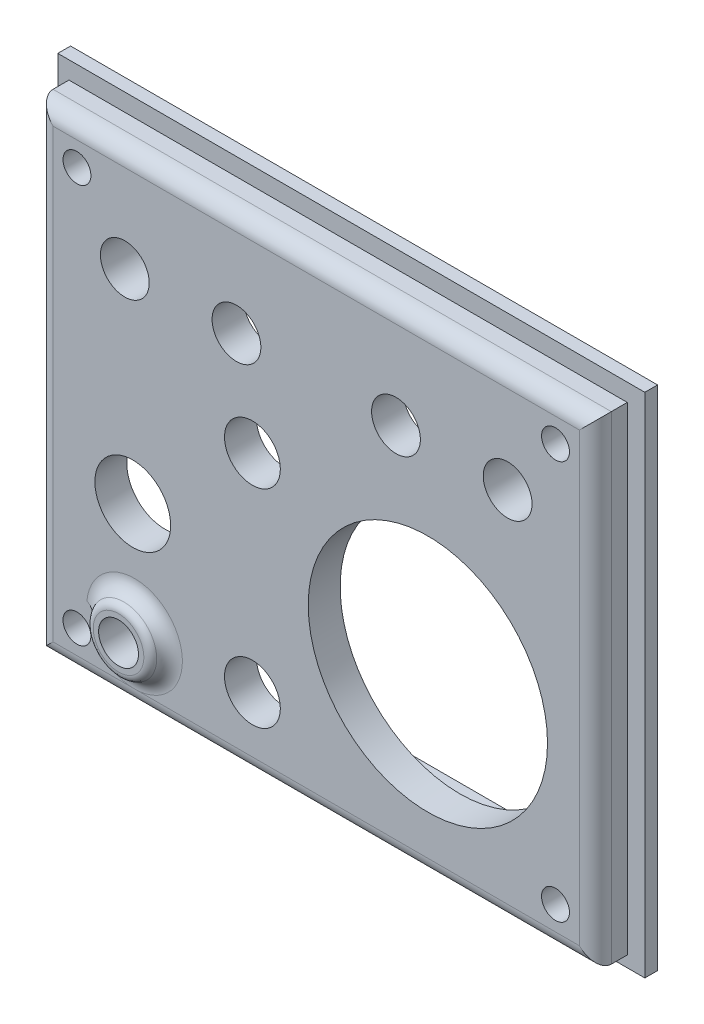
from build123d import *

# Parameters (mm, degrees)
SKETCH1_W               = 70
SKETCH1_H               = 60
BOSS_EXTRUDE1_DEPTH     = 4
SKETCH2_W               = 63.6
SKETCH2_H               = 53.6
SKETCH2_W_2             = 57.6
SKETCH2_H_2             = 47.6
BOSS_EXTRUDE2_DEPTH     = 2
CHAMFER1_SIZE           = 0.5
CHAMFER1_SIZE2          = 1.37373871
FILLET1_R               = 2
SKETCH3_R               = 3.060318858
CUT_EXTRUDE1_DEPTH      = 47.486557197
SKETCH4_R               = 15
CUT_EXTRUDE2_DEPTH      = 47.486557197
SKETCH5_R               = 3.5
CUT_EXTRUDE3_DEPTH      = 47.486557197
SKETCH6_R               = 5
SKETCH6_R_2             = 3.060318858
BOSS_EXTRUDE3_DEPTH     = 2
FILLET2_R               = 1
CUT_EXTRUDE4_REACH      = 48.487
SKETCH7_W               = 20
SKETCH7_H               = 60
SKETCH8_R               = 4.75
CUT_EXTRUDE5_DEPTH      = 47.270941205
CUT_EXTRUDE6_DEPTH      = 47.270941205
CUT_EXTRUDE6_DEPTH_BACK = 47.270941205
SKETCH9_R               = 1.75
SKETCH10_R              = 2
CUT_EXTRUDE7_DEPTH      = 2
SKETCH11_R              = 5
SKETCH11_R_2            = 3.060318858
BOSS_EXTRUDE4_DEPTH     = 2
SKETCH12_R              = 5
CUT_EXTRUDE9_DEPTH      = 47.270941205
SKETCH13_R              = 2.5
CUT_EXTRUDE10_DEPTH     = 47.270941205
SKETCH14_W              = 9
SKETCH14_H              = 9
SKETCH14_W_2            = 6.5
SKETCH14_H_2            = 6.5
BOSS_EXTRUDE5_DEPTH     = 2
SKETCH17_R              = 4
SKETCH17_R_2            = 2.5
BOSS_EXTRUDE7_DEPTH     = 2
FILLET5_R               = 2
FILLET6_R               = 1
SKETCH18_R              = 3.75
CUT_EXTRUDE13_DEPTH     = 47.486557197
BOSS_EXTRUDE8_START     = 0.4
SKETCH19_W              = 73.6
SKETCH19_H              = 63.6
SKETCH19_W_2            = 65.6
SKETCH19_H_2            = 55.6
BOSS_EXTRUDE8_DEPTH     = 1.6
SKETCH21_R              = 9.090654542
CUT_EXTRUDE15_DEPTH     = 50.004897727
SKETCH20_W              = 4.957633968
SKETCH20_H              = 6.255912851
SUPPORT_DEPTH           = 1.6


with BuildPart() as part:
    # Sketch1 → Boss-Extrude1 (new body)
    with BuildSketch(Plane.XY):
        Rectangle(SKETCH1_W, SKETCH1_H)
    extrude(amount=BOSS_EXTRUDE1_DEPTH)

    # Sketch2 → Boss-Extrude2 (add)
    with BuildSketch(Plane(origin=(0, 0, 0), x_dir=(-1, 0, 0), z_dir=(0, 0, -1))):
        Rectangle(SKETCH2_W, SKETCH2_H)
        Rectangle(SKETCH2_W_2, SKETCH2_H_2, mode=Mode.SUBTRACT)
    extrude(amount=BOSS_EXTRUDE2_DEPTH)

    # Chamfer1
    chamfer1_edges = [part.edges().sort_by_distance(p)[0] for p in [
        (-31.8, 0, -2),
        (0, 26.8, -2),
        (31.8, 0, -2),
        (0, -26.8, -2),
    ]]
    chamfer1_side = [part.faces().sort_by_distance(p)[0] for p in [
        (0, 25.968259656, -2),
    ]]
    chamfer(chamfer1_edges, length=CHAMFER1_SIZE, length2=CHAMFER1_SIZE2, reference=chamfer1_side[0])

    # Fillet1
    fillet1_edges = [part.edges().sort_by_distance(p)[0] for p in [
        (35, 0, 4),
        (0, 30, 4),
        (-35, 0, 4),
        (0, -30, 4),
    ]]
    fillet(fillet1_edges, radius=FILLET1_R)

    # Sketch3 → Cut-Extrude1 (cut, through all)
    with BuildSketch(Plane.XY.offset(4)):
        with Locations((-24, 17)):
            Circle(SKETCH3_R)
        with Locations((10, 17)):
            Circle(SKETCH3_R)
        with Locations((-10, 17)):
            Circle(SKETCH3_R)
        with Locations((24, 17)):
            Circle(SKETCH3_R)
    extrude(amount=-CUT_EXTRUDE1_DEPTH, mode=Mode.SUBTRACT)

    # Sketch4 → Cut-Extrude2 (cut, through all)
    with BuildSketch(Plane.XY.offset(4)):
        with Locations((14, -8)):
            Circle(SKETCH4_R)
    extrude(amount=-CUT_EXTRUDE2_DEPTH, mode=Mode.SUBTRACT)

    # Sketch5 → Cut-Extrude3 (cut, through all)
    with BuildSketch(Plane.XY.offset(4)):
        with Locations((-8, 5)):
            Circle(SKETCH5_R)
        with Locations((-8, -21)):
            Circle(SKETCH5_R)
    extrude(amount=-CUT_EXTRUDE3_DEPTH, mode=Mode.SUBTRACT)

    # Sketch6 → Boss-Extrude3 (add)
    # profile 1 of 2: a face of its own
    with BuildSketch(Plane(origin=(0, 0, 0), x_dir=(-1, 0, 0), z_dir=(0, 0, -1))):
        with Locations((24, 17)):
            Circle(SKETCH6_R)
        with Locations(Location((24, 17, 0), (0, 0, 180))):
            Circle(SKETCH6_R_2, mode=Mode.SUBTRACT)
    # profile 2 of 2: a face of its own
    with BuildSketch(Plane(origin=(0, 0, 0), x_dir=(-1, 0, 0), z_dir=(0, 0, -1))):
        with Locations((-24, 17)):
            Circle(SKETCH6_R)
        with Locations(Location((-24, 17, 0), (0, 0, 180))):
            Circle(SKETCH6_R_2, mode=Mode.SUBTRACT)
    extrude(amount=BOSS_EXTRUDE3_DEPTH)

    # Fillet2
    fillet2_edges = [part.edges().sort_by_distance(p)[0] for p in [
        (28.8, 18.4, -1),
        (28.8, 15.6, -1),
        (28.8, 23.8, -1),
    ]]
    fillet(fillet2_edges, radius=FILLET2_R)

    # Cut-Extrude4: up to this face of the body (flat: up to its plane)
    cut_extrude4_end = Plane(part.part.faces().sort_by_distance((-5.37613494, 1.437428998, 0))[0])
    # Sketch7 → Cut-Extrude4 (cut, up to the picked face)
    with BuildSketch(Plane(origin=(0, 0, -2), x_dir=(-1, 0, 0), z_dir=(0, 0, -1)), mode=Mode.PRIVATE) as cut_extrude4_sk1:
        with Locations((25, -2.259161332)):
            Rectangle(SKETCH7_W, SKETCH7_H)
    cut_extrude4_tool1 = split(extrude(cut_extrude4_sk1.sketch, amount=-CUT_EXTRUDE4_REACH, mode=Mode.PRIVATE), bisect_by=cut_extrude4_end, keep=Keep.BOTH, mode=Mode.PRIVATE)
    add(cut_extrude4_tool1.solids().sort_by(Axis((-25, -2.259161, -2), (0, 0, 1)))[0], mode=Mode.SUBTRACT)

    # Sketch8 → Cut-Extrude5 (cut, through all)
    with BuildSketch(Plane(origin=(0, 0, 0), x_dir=(-1, 0, 0), z_dir=(0, 0, -1))):
        with Locations((23, -8)):
            Circle(SKETCH8_R)
    extrude(amount=-CUT_EXTRUDE5_DEPTH, mode=Mode.SUBTRACT)

    # Sketch9 → Cut-Extrude6 (cut, two sides: drawn at the far end of the back side and taken through both)
    with BuildSketch(Plane(origin=(0, 0, 0), x_dir=(-1, 0, 0), z_dir=(0, 0, -1)).offset(-CUT_EXTRUDE6_DEPTH_BACK)):
        with Locations((30, 25)):
            Circle(SKETCH9_R)
        with Locations((30, -25)):
            Circle(SKETCH9_R)
        with Locations((-30, -25)):
            Circle(SKETCH9_R)
        with Locations((-30, 25)):
            Circle(SKETCH9_R)
    extrude(amount=CUT_EXTRUDE6_DEPTH + CUT_EXTRUDE6_DEPTH_BACK, mode=Mode.SUBTRACT)

    # Sketch10 → Cut-Extrude7 (cut)
    with BuildSketch(Plane(origin=(0, 0, 0), x_dir=(-1, 0, 0), z_dir=(0, 0, -1))):
        with Locations((23, 1)):
            Circle(SKETCH10_R)
    extrude(amount=-CUT_EXTRUDE7_DEPTH, mode=Mode.SUBTRACT)

    # Sketch11 → Boss-Extrude4 (add)
    with BuildSketch(Plane(origin=(0, 0, 0), x_dir=(-1, 0, 0), z_dir=(0, 0, -1))):
        with Locations(Location((24, 17, 0), (0, 0, 180))):
            Circle(SKETCH11_R)
        with Locations(Location((24, 17, 0), (0, 0, 180))):
            Circle(SKETCH11_R_2, mode=Mode.SUBTRACT)
    extrude(amount=BOSS_EXTRUDE4_DEPTH)

    # Sketch12 → Cut-Extrude9 (cut, through all)
    with BuildSketch(Plane(origin=(0, 0, 0), x_dir=(-1, 0, 0), z_dir=(0, 0, -1))):
        with Locations((-30, 25)):
            Circle(SKETCH12_R)
        with Locations((-30, -25)):
            Circle(SKETCH12_R)
    extrude(amount=CUT_EXTRUDE9_DEPTH, mode=Mode.SUBTRACT)

    # Sketch13 → Cut-Extrude10 (cut, through all)
    with BuildSketch(Plane(origin=(0, 0, 0), x_dir=(-1, 0, 0), z_dir=(0, 0, -1))):
        with Locations((22.783208656, -22)):
            Circle(SKETCH13_R)
    extrude(amount=-CUT_EXTRUDE10_DEPTH, mode=Mode.SUBTRACT)

    # Sketch14 → Boss-Extrude5 (add)
    with BuildSketch(Plane(origin=(0, 0, 0), x_dir=(-1, 0, 0), z_dir=(0, 0, -1))):
        with Locations((22.783208656, -22)):
            Rectangle(SKETCH14_W, SKETCH14_H)
        with Locations((22.783208656, -22)):
            Rectangle(SKETCH14_W_2, SKETCH14_H_2, mode=Mode.SUBTRACT)
    extrude(amount=BOSS_EXTRUDE5_DEPTH)

    # Sketch17 → Boss-Extrude7 (add)
    with BuildSketch(Plane.XY.offset(4)):
        with Locations((-22.783208656, -22)):
            Circle(SKETCH17_R)
        with Locations(Location((-22.783208656, -22, 0), (0, 0, 180))):
            Circle(SKETCH17_R_2, mode=Mode.SUBTRACT)
    extrude(amount=BOSS_EXTRUDE7_DEPTH)

    # Fillet5
    fillet5_edges = [part.edges().sort_by_distance(p)[0] for p in [
        (-26.783208656, -22, 4),
    ]]
    fillet(fillet5_edges, radius=FILLET5_R - 0.0001)  # a hair under: the kernel refuses the full size

    # Fillet6
    fillet6_edges = [part.edges().sort_by_distance(p)[0] for p in [
        (-26.783208656, -22, 6),
    ]]
    fillet(fillet6_edges, radius=FILLET6_R)

    # Sketch18 → Cut-Extrude13 (cut, through all)
    with BuildSketch(Plane.XY.offset(4)):
        with Locations((-30, -25)):
            Circle(SKETCH18_R)
    extrude(amount=CUT_EXTRUDE13_DEPTH, mode=Mode.SUBTRACT)

    # Sketch21 → Cut-Extrude15 (cut, through all)
    with BuildSketch(Plane(origin=(0, 0, 0), x_dir=(-1, 0, 0), z_dir=(0, 0, -1))):
        with Locations((8, -21)):
            Circle(SKETCH21_R)
    extrude(amount=CUT_EXTRUDE15_DEPTH, mode=Mode.SUBTRACT)


with BuildPart() as body_2:
    # Sketch19 → Boss-Extrude8 (new body)
    with BuildSketch(Plane(origin=(0, 0, 0), x_dir=(-1, 0, 0), z_dir=(0, 0, -1)).offset(BOSS_EXTRUDE8_START)):
        Rectangle(SKETCH19_W, SKETCH19_H)
        Rectangle(SKETCH19_W_2, SKETCH19_H_2, mode=Mode.SUBTRACT)
    extrude(amount=BOSS_EXTRUDE8_DEPTH)

    # Sketch20 → support (add)
    with BuildSketch(Plane(origin=(0, 0, -2), x_dir=(-1, 0, 0), z_dir=(0, 0, -1))):
        with BuildLine():
            Line((-27.256195726, 27.8), (-32.8, 27.8))
            Line((-32.8, 27.8), (-32.8, 22.256195726))
            ThreePointArc((-32.8, 22.256195726), (-27.716473501, 22.716473501), (-27.256195726, 27.8))
        make_face()
        with BuildLine():
            Line((-32.8, -22.256195726), (-32.8, -27.8))
            Line((-32.8, -27.8), (-27.256195726, -27.8))
            ThreePointArc((-27.256195726, -27.8), (-27.716473501, -22.716473501), (-32.8, -22.256195726))
        make_face()
        with BuildLine():
            Line((25.880176368, 27.8), (32.8, 27.8))
            Line((32.8, 27.8), (32.8, 20.558285253))
            ThreePointArc((32.8, 20.558285253), (28.167025653, 23.058222222), (25.880176368, 27.8))
        make_face()
        with Locations((30.321183016, -24.672043575)):
            Rectangle(SKETCH20_W, SKETCH20_H)
    extrude(amount=-SUPPORT_DEPTH)


solid = Compound([part.part, body_2.part])
